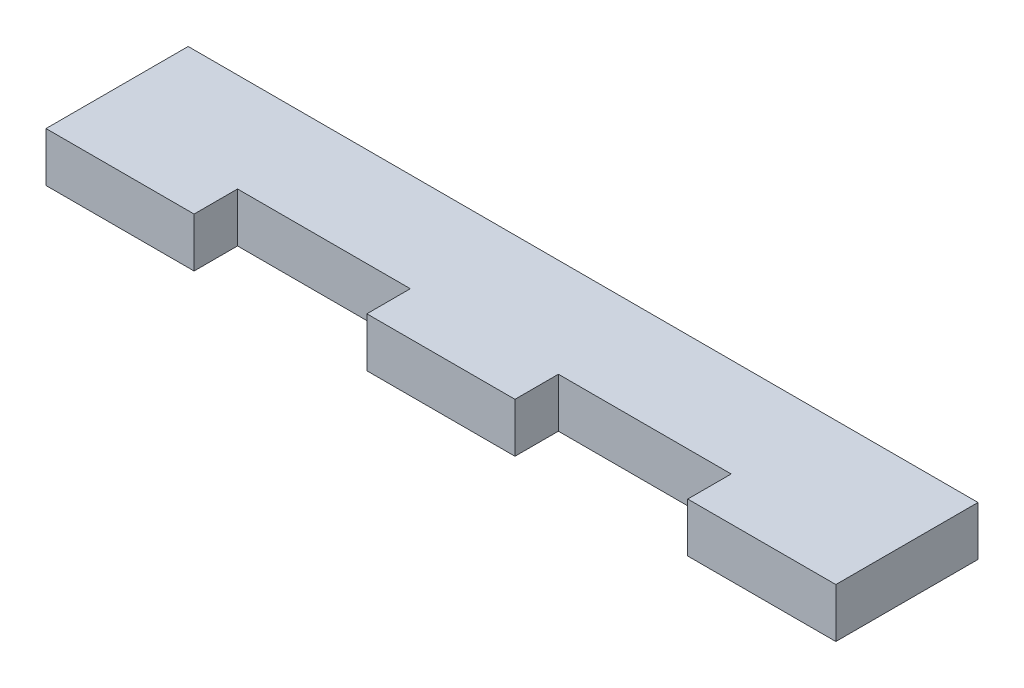
from build123d import *

# Parameters (mm, degrees)
BOSS_EXTRUDE1_DEPTH = 6.35


with BuildPart() as part:
    # Sketch1 → Boss-Extrude1 (new body)
    with BuildSketch(Plane(origin=(0, 0, 0), x_dir=(1, 0, 0), z_dir=(0, 1, 0))):
        Polygon((-9.525, -6.35), (-9.525, -11.938), (9.525, -11.938), (9.525, -6.35), (31.75, -6.35), (31.75, -11.938), (50.8, -11.938), (50.8, -6.35), (50.8, 6.35), (-50.8, 6.35), (-50.8, -6.35), (-50.8, -11.938), (-31.75, -11.938), (-31.75, -6.35), align=None)
    extrude(amount=BOSS_EXTRUDE1_DEPTH)


solid = part.part
